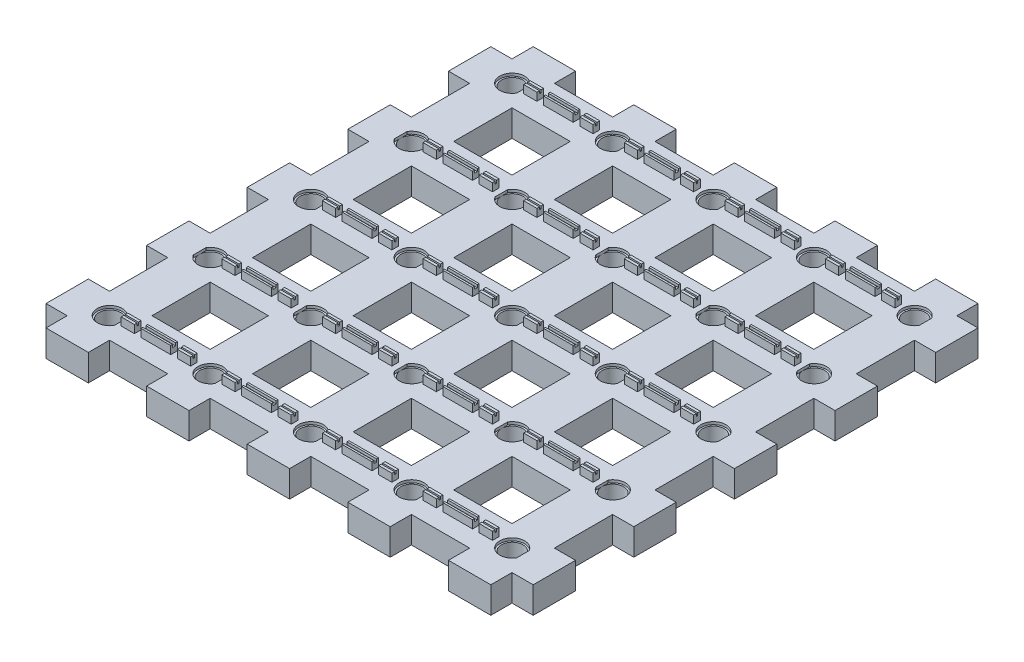
from build123d import *

# Parameters (mm, degrees)
SKETCH1_W                    = 220
SKETCH1_H                    = 220
BOSS_EXTRUDE1_DEPTH          = 10
SKETCH2_R                    = 4.075
CUT_EXTRUDE1_DEPTH           = 10
CUT_EXTRUDE2_DEPTH           = 1
SKETCH4_W                    = 220
SKETCH4_H                    = 220
SKETCH4_W_2                  = 22
SKETCH4_H_2                  = 22
CUT_EXTRUDE3_DEPTH           = 156.884572681
SKETCH5_W                    = 5
SKETCH5_H                    = 2.5
SKETCH5_W_2                  = 11.225
SKETCH5_H_2                  = 2.509475446
BOSS_EXTRUDE2_DEPTH          = 3
SKETCH6_W                    = 5
SKETCH6_H                    = 0.55
SKETCH6_W_2                  = 11.225
SKETCH6_H_2                  = 1.1
CUT_EXTRUDE4_DEPTH           = 1
LPATTERN1_COUNT              = 5
LPATTERN1_PITCH              = 38
LPATTERN2_COPY_1_SKETCH_W    = 5
LPATTERN2_COPY_1_SKETCH_H    = 2.5
LPATTERN2_COPY_1_SKETCH_W_2  = 11.225
LPATTERN2_COPY_1_SKETCH_H_2  = 2.509475446
LPATTERN2_COPY_1_DEPTH       = 3
LPATTERN2_COPY_2_SKETCH_W    = 5
LPATTERN2_COPY_2_SKETCH_H    = 2.5
LPATTERN2_COPY_2_SKETCH_W_2  = 11.225
LPATTERN2_COPY_2_SKETCH_H_2  = 2.509475446
LPATTERN2_COPY_2_DEPTH       = 3
LPATTERN2_COPY_3_SKETCH_W    = 5
LPATTERN2_COPY_3_SKETCH_H    = 2.5
LPATTERN2_COPY_3_SKETCH_W_2  = 11.225
LPATTERN2_COPY_3_SKETCH_H_2  = 2.509475446
LPATTERN2_COPY_3_DEPTH       = 3
LPATTERN2_COPY_4_SKETCH_W    = 5
LPATTERN2_COPY_4_SKETCH_H    = 2.5
LPATTERN2_COPY_4_SKETCH_W_2  = 11.225
LPATTERN2_COPY_4_SKETCH_H_2  = 2.509475446
LPATTERN2_COPY_4_DEPTH       = 3
LPATTERN2_COPY_5_SKETCH_W    = 5
LPATTERN2_COPY_5_SKETCH_H    = 2.5
LPATTERN2_COPY_5_SKETCH_W_2  = 11.225
LPATTERN2_COPY_5_SKETCH_H_2  = 2.509475446
LPATTERN2_COPY_5_DEPTH       = 3
LPATTERN2_COPY_6_SKETCH_W    = 5
LPATTERN2_COPY_6_SKETCH_H    = 2.5
LPATTERN2_COPY_6_SKETCH_W_2  = 11.225
LPATTERN2_COPY_6_SKETCH_H_2  = 2.509475446
LPATTERN2_COPY_6_DEPTH       = 3
LPATTERN2_COPY_7_SKETCH_W    = 5
LPATTERN2_COPY_7_SKETCH_H    = 2.5
LPATTERN2_COPY_7_SKETCH_W_2  = 11.225
LPATTERN2_COPY_7_SKETCH_H_2  = 2.509475446
LPATTERN2_COPY_7_DEPTH       = 3
LPATTERN2_COPY_8_SKETCH_W    = 5
LPATTERN2_COPY_8_SKETCH_H    = 2.5
LPATTERN2_COPY_8_SKETCH_W_2  = 11.225
LPATTERN2_COPY_8_SKETCH_H_2  = 2.509475446
LPATTERN2_COPY_8_DEPTH       = 3
LPATTERN2_COPY_9_SKETCH_W    = 5
LPATTERN2_COPY_9_SKETCH_H    = 2.5
LPATTERN2_COPY_9_SKETCH_W_2  = 11.225
LPATTERN2_COPY_9_SKETCH_H_2  = 2.509475446
LPATTERN2_COPY_9_DEPTH       = 3
LPATTERN2_COPY_10_SKETCH_W   = 5
LPATTERN2_COPY_10_SKETCH_H   = 2.5
LPATTERN2_COPY_10_SKETCH_W_2 = 11.225
LPATTERN2_COPY_10_SKETCH_H_2 = 2.509475446
LPATTERN2_COPY_10_DEPTH      = 3
LPATTERN2_COPY_11_SKETCH_W   = 5
LPATTERN2_COPY_11_SKETCH_H   = 2.5
LPATTERN2_COPY_11_SKETCH_W_2 = 11.225
LPATTERN2_COPY_11_SKETCH_H_2 = 2.509475446
LPATTERN2_COPY_11_DEPTH      = 3
LPATTERN2_COPY_12_SKETCH_W   = 5
LPATTERN2_COPY_12_SKETCH_H   = 2.5
LPATTERN2_COPY_12_SKETCH_W_2 = 11.225
LPATTERN2_COPY_12_SKETCH_H_2 = 2.509475446
LPATTERN2_COPY_12_DEPTH      = 3
LPATTERN2_COPY_13_SKETCH_W   = 5
LPATTERN2_COPY_13_SKETCH_H   = 0.55
LPATTERN2_COPY_13_SKETCH_W_2 = 11.225
LPATTERN2_COPY_13_SKETCH_H_2 = 1.1
LPATTERN2_COPY_13_DEPTH      = 1
LPATTERN2_COPY_14_SKETCH_W   = 5
LPATTERN2_COPY_14_SKETCH_H   = 0.55
LPATTERN2_COPY_14_SKETCH_W_2 = 11.225
LPATTERN2_COPY_14_SKETCH_H_2 = 1.1
LPATTERN2_COPY_14_DEPTH      = 1
LPATTERN2_COPY_15_SKETCH_W   = 5
LPATTERN2_COPY_15_SKETCH_H   = 0.55
LPATTERN2_COPY_15_SKETCH_W_2 = 11.225
LPATTERN2_COPY_15_SKETCH_H_2 = 1.1
LPATTERN2_COPY_15_DEPTH      = 1
LPATTERN2_COPY_16_SKETCH_W   = 5
LPATTERN2_COPY_16_SKETCH_H   = 0.55
LPATTERN2_COPY_16_SKETCH_W_2 = 11.225
LPATTERN2_COPY_16_SKETCH_H_2 = 1.1
LPATTERN2_COPY_16_DEPTH      = 1
LPATTERN2_COPY_17_SKETCH_W   = 5
LPATTERN2_COPY_17_SKETCH_H   = 0.55
LPATTERN2_COPY_17_SKETCH_W_2 = 11.225
LPATTERN2_COPY_17_SKETCH_H_2 = 1.1
LPATTERN2_COPY_17_DEPTH      = 1
LPATTERN2_COPY_18_SKETCH_W   = 5
LPATTERN2_COPY_18_SKETCH_H   = 0.55
LPATTERN2_COPY_18_SKETCH_W_2 = 11.225
LPATTERN2_COPY_18_SKETCH_H_2 = 1.1
LPATTERN2_COPY_18_DEPTH      = 1
LPATTERN2_COPY_19_SKETCH_W   = 5
LPATTERN2_COPY_19_SKETCH_H   = 0.55
LPATTERN2_COPY_19_SKETCH_W_2 = 11.225
LPATTERN2_COPY_19_SKETCH_H_2 = 1.1
LPATTERN2_COPY_19_DEPTH      = 1
LPATTERN2_COPY_20_SKETCH_W   = 5
LPATTERN2_COPY_20_SKETCH_H   = 0.55
LPATTERN2_COPY_20_SKETCH_W_2 = 11.225
LPATTERN2_COPY_20_SKETCH_H_2 = 1.1
LPATTERN2_COPY_20_DEPTH      = 1
LPATTERN2_COPY_21_SKETCH_W   = 5
LPATTERN2_COPY_21_SKETCH_H   = 0.55
LPATTERN2_COPY_21_SKETCH_W_2 = 11.225
LPATTERN2_COPY_21_SKETCH_H_2 = 1.1
LPATTERN2_COPY_21_DEPTH      = 1
LPATTERN2_COPY_22_SKETCH_W   = 5
LPATTERN2_COPY_22_SKETCH_H   = 0.55
LPATTERN2_COPY_22_SKETCH_W_2 = 11.225
LPATTERN2_COPY_22_SKETCH_H_2 = 1.1
LPATTERN2_COPY_22_DEPTH      = 1
LPATTERN2_COPY_23_SKETCH_W   = 5
LPATTERN2_COPY_23_SKETCH_H   = 0.55
LPATTERN2_COPY_23_SKETCH_W_2 = 11.225
LPATTERN2_COPY_23_SKETCH_H_2 = 1.1
LPATTERN2_COPY_23_DEPTH      = 1
LPATTERN2_COPY_24_SKETCH_W   = 5
LPATTERN2_COPY_24_SKETCH_H   = 0.55
LPATTERN2_COPY_24_SKETCH_W_2 = 11.225
LPATTERN2_COPY_24_SKETCH_H_2 = 1.1
LPATTERN2_COPY_24_DEPTH      = 1
LPATTERN2_COPY_25_SKETCH_W   = 5
LPATTERN2_COPY_25_SKETCH_H   = 2.5
LPATTERN2_COPY_25_SKETCH_W_2 = 11.225
LPATTERN2_COPY_25_SKETCH_H_2 = 2.509475446
LPATTERN2_COPY_25_DEPTH      = 3
LPATTERN2_COPY_26_SKETCH_W   = 5
LPATTERN2_COPY_26_SKETCH_H   = 2.5
LPATTERN2_COPY_26_SKETCH_W_2 = 11.225
LPATTERN2_COPY_26_SKETCH_H_2 = 2.509475446
LPATTERN2_COPY_26_DEPTH      = 3
LPATTERN2_COPY_27_SKETCH_W   = 5
LPATTERN2_COPY_27_SKETCH_H   = 2.5
LPATTERN2_COPY_27_SKETCH_W_2 = 11.225
LPATTERN2_COPY_27_SKETCH_H_2 = 2.509475446
LPATTERN2_COPY_27_DEPTH      = 3
LPATTERN2_COPY_28_SKETCH_W   = 5
LPATTERN2_COPY_28_SKETCH_H   = 0.55
LPATTERN2_COPY_28_SKETCH_W_2 = 11.225
LPATTERN2_COPY_28_SKETCH_H_2 = 1.1
LPATTERN2_COPY_28_DEPTH      = 1
LPATTERN2_COPY_29_SKETCH_W   = 5
LPATTERN2_COPY_29_SKETCH_H   = 0.55
LPATTERN2_COPY_29_SKETCH_W_2 = 11.225
LPATTERN2_COPY_29_SKETCH_H_2 = 1.1
LPATTERN2_COPY_29_DEPTH      = 1
LPATTERN2_COPY_30_SKETCH_W   = 5
LPATTERN2_COPY_30_SKETCH_H   = 0.55
LPATTERN2_COPY_30_SKETCH_W_2 = 11.225
LPATTERN2_COPY_30_SKETCH_H_2 = 1.1
LPATTERN2_COPY_30_DEPTH      = 1


with BuildPart() as part:
    # Sketch1 → Boss-Extrude1 (new body)
    with BuildSketch(Plane(origin=(0, 0, 0), x_dir=(1, 0, 0), z_dir=(0, 1, 0))):
        Rectangle(SKETCH1_W, SKETCH1_H)
    extrude(amount=BOSS_EXTRUDE1_DEPTH)

    # Sketch2 → Cut-Extrude1 (cut)
    with BuildSketch(Plane(origin=(0, 10, 0), x_dir=(1, 0, 0), z_dir=(0, 1, 0))):
        with Locations((-76, -75.925)):
            Circle(SKETCH2_R)
        with Locations((-38, -75.925)):
            Circle(SKETCH2_R)
        with Locations((0, -75.925)):
            Circle(SKETCH2_R)
        with Locations((38, -75.925)):
            Circle(SKETCH2_R)
        with Locations((76, -75.925)):
            Circle(SKETCH2_R)
        with Locations((-76, -37.925)):
            Circle(SKETCH2_R)
        with Locations((-38, -37.925)):
            Circle(SKETCH2_R)
        with Locations((0, -37.925)):
            Circle(SKETCH2_R)
        with Locations((38, -37.925)):
            Circle(SKETCH2_R)
        with Locations((76, -37.925)):
            Circle(SKETCH2_R)
        with Locations((-76, 0.075)):
            Circle(SKETCH2_R)
        with Locations((-38, 0.075)):
            Circle(SKETCH2_R)
        with Locations((0, 0.075)):
            Circle(SKETCH2_R)
        with Locations((38, 0.075)):
            Circle(SKETCH2_R)
        with Locations((76, 0.075)):
            Circle(SKETCH2_R)
        with Locations((-76, 38.075)):
            Circle(SKETCH2_R)
        with Locations((-38, 38.075)):
            Circle(SKETCH2_R)
        with Locations((0, 38.075)):
            Circle(SKETCH2_R)
        with Locations((38, 38.075)):
            Circle(SKETCH2_R)
        with Locations((76, 38.075)):
            Circle(SKETCH2_R)
        with Locations((-76, 76.075)):
            Circle(SKETCH2_R)
        with Locations((-38, 76.075)):
            Circle(SKETCH2_R)
        with Locations((0, 76.075)):
            Circle(SKETCH2_R)
        with Locations((38, 76.075)):
            Circle(SKETCH2_R)
        with Locations((76, 76.075)):
            Circle(SKETCH2_R)
    extrude(amount=-CUT_EXTRUDE1_DEPTH, mode=Mode.SUBTRACT)

    # Sketch3 → Cut-Extrude2 (cut)
    with BuildSketch(Plane(origin=(0, 10, 0), x_dir=(1, 0, 0), z_dir=(0, 1, 0))):
        with BuildLine():
            Line((-71.925, -78.266874249), (-71.925, -73.583125751))
            ThreePointArc((-71.925, -73.583125751), (-80.7, -75.925), (-71.925, -78.266874249))
        make_face()
        with BuildLine():
            Line((-80.075, -35.583125751), (-80.075, -40.266874249))
            ThreePointArc((-80.075, -40.266874249), (-71.3, -37.925), (-80.075, -35.583125751))
        make_face()
        with BuildLine():
            Line((-71.925, -2.266874249), (-71.925, 2.416874249))
            ThreePointArc((-71.925, 2.416874249), (-80.7, 0.075), (-71.925, -2.266874249))
        make_face()
        with BuildLine():
            Line((-80.075, 40.416874249), (-80.075, 35.733125751))
            ThreePointArc((-80.075, 35.733125751), (-71.3, 38.075), (-80.075, 40.416874249))
        make_face()
        with BuildLine():
            Line((-71.925, 73.733125751), (-71.925, 78.416874249))
            ThreePointArc((-71.925, 78.416874249), (-80.7, 76.075), (-71.925, 73.733125751))
        make_face()
        with BuildLine():
            Line((-33.925, 73.733125751), (-33.925, 78.416874249))
            ThreePointArc((-33.925, 78.416874249), (-42.7, 76.075), (-33.925, 73.733125751))
        make_face()
        with BuildLine():
            Line((-42.075, 40.416874249), (-42.075, 35.733125751))
            ThreePointArc((-42.075, 35.733125751), (-33.3, 38.075), (-42.075, 40.416874249))
        make_face()
        with BuildLine():
            Line((-33.925, -2.266874249), (-33.925, 2.416874249))
            ThreePointArc((-33.925, 2.416874249), (-42.7, 0.075), (-33.925, -2.266874249))
        make_face()
        with BuildLine():
            Line((-33.925, -78.266874249), (-33.925, -73.583125751))
            ThreePointArc((-33.925, -73.583125751), (-42.7, -75.925), (-33.925, -78.266874249))
        make_face()
        with BuildLine():
            Line((-42.075, -35.583125751), (-42.075, -40.266874249))
            ThreePointArc((-42.075, -40.266874249), (-33.3, -37.925), (-42.075, -35.583125751))
        make_face()
        with BuildLine():
            Line((4.075, 73.733125751), (4.075, 78.416874249))
            ThreePointArc((4.075, 78.416874249), (-4.7, 76.075), (4.075, 73.733125751))
        make_face()
        with BuildLine():
            Line((-4.075, 40.416874249), (-4.075, 35.733125751))
            ThreePointArc((-4.075, 35.733125751), (4.7, 38.075), (-4.075, 40.416874249))
        make_face()
        with BuildLine():
            Line((4.075, -2.266874249), (4.075, 2.416874249))
            ThreePointArc((4.075, 2.416874249), (-4.7, 0.075), (4.075, -2.266874249))
        make_face()
        with BuildLine():
            Line((4.075, -78.266874249), (4.075, -73.583125751))
            ThreePointArc((4.075, -73.583125751), (-4.7, -75.925), (4.075, -78.266874249))
        make_face()
        with BuildLine():
            Line((-4.075, -35.583125751), (-4.075, -40.266874249))
            ThreePointArc((-4.075, -40.266874249), (4.7, -37.925), (-4.075, -35.583125751))
        make_face()
        with BuildLine():
            Line((42.075, 73.733125751), (42.075, 78.416874249))
            ThreePointArc((42.075, 78.416874249), (33.3, 76.075), (42.075, 73.733125751))
        make_face()
        with BuildLine():
            Line((33.925, 40.416874249), (33.925, 35.733125751))
            ThreePointArc((33.925, 35.733125751), (42.7, 38.075), (33.925, 40.416874249))
        make_face()
        with BuildLine():
            Line((42.075, -2.266874249), (42.075, 2.416874249))
            ThreePointArc((42.075, 2.416874249), (33.3, 0.075), (42.075, -2.266874249))
        make_face()
        with BuildLine():
            Line((42.075, -78.266874249), (42.075, -73.583125751))
            ThreePointArc((42.075, -73.583125751), (33.3, -75.925), (42.075, -78.266874249))
        make_face()
        with BuildLine():
            Line((33.925, -35.583125751), (33.925, -40.266874249))
            ThreePointArc((33.925, -40.266874249), (42.7, -37.925), (33.925, -35.583125751))
        make_face()
        with BuildLine():
            Line((80.075, 73.733125751), (80.075, 78.416874249))
            ThreePointArc((80.075, 78.416874249), (71.3, 76.075), (80.075, 73.733125751))
        make_face()
        with BuildLine():
            Line((71.925, 40.416874249), (71.925, 35.733125751))
            ThreePointArc((71.925, 35.733125751), (80.7, 38.075), (71.925, 40.416874249))
        make_face()
        with BuildLine():
            Line((80.075, -2.266874249), (80.075, 2.416874249))
            ThreePointArc((80.075, 2.416874249), (71.3, 0.075), (80.075, -2.266874249))
        make_face()
        with BuildLine():
            Line((80.075, -78.266874249), (80.075, -73.583125751))
            ThreePointArc((80.075, -73.583125751), (71.3, -75.925), (80.075, -78.266874249))
        make_face()
        with BuildLine():
            Line((71.925, -35.583125751), (71.925, -40.266874249))
            ThreePointArc((71.925, -40.266874249), (80.7, -37.925), (71.925, -35.583125751))
        make_face()
    extrude(amount=-CUT_EXTRUDE2_DEPTH, mode=Mode.SUBTRACT)

    # Sketch4 → Cut-Extrude3 (cut, through all)
    # profile 1 of 17: a face of its own
    with BuildSketch(Plane(origin=(0, 10, 0), x_dir=(1, 0, 0), z_dir=(0, 1, 0))):
        Rectangle(SKETCH4_W, SKETCH4_H)
        Polygon((-68, 92), (-68, 84), (-46, 84), (-46, 92), (-30, 92), (-30, 84), (-8, 84), (-8, 92), (8, 92), (8, 84), (30, 84), (30, 92), (46, 92), (46, 84), (68, 84), (68, 92), (84, 92), (84, 84), (92, 84), (92, 68), (84, 68), (84, 46), (92, 46), (92, 30), (84, 30), (84, 8), (92, 8), (92, -8), (84, -8), (84, -30), (92, -30), (92, -46), (84, -46), (84, -68), (92, -68), (92, -84), (84, -84), (84, -92), (68, -92), (68, -84), (46, -84), (46, -92), (30, -92), (30, -84), (8, -84), (8, -92), (-8, -92), (-8, -84), (-30, -84), (-30, -92), (-46, -92), (-46, -84), (-68, -84), (-68, -92), (-84, -92), (-84, -84), (-92, -84), (-92, -68), (-84, -68), (-84, -46), (-92, -46), (-92, -30), (-84, -30), (-84, -8), (-92, -8), (-92, 8), (-84, 8), (-84, 30), (-92, 30), (-92, 46), (-84, 46), (-84, 68), (-92, 68), (-92, 84), (-84, 84), (-84, 92), align=None, mode=Mode.SUBTRACT)
    # profile 2 of 17: a face of its own
    with BuildSketch(Plane(origin=(0, 10, 0), x_dir=(1, 0, 0), z_dir=(0, 1, 0))):
        with Locations((-57, -57)):
            Rectangle(SKETCH4_W_2, SKETCH4_H_2)
    # profile 3 of 17: a face of its own
    with BuildSketch(Plane(origin=(0, 10, 0), x_dir=(1, 0, 0), z_dir=(0, 1, 0))):
        with Locations((57, -57)):
            Rectangle(SKETCH4_W_2, SKETCH4_H_2)
    # profile 4 of 17: a face of its own
    with BuildSketch(Plane(origin=(0, 10, 0), x_dir=(1, 0, 0), z_dir=(0, 1, 0))):
        with Locations((19, -57)):
            Rectangle(SKETCH4_W_2, SKETCH4_H_2)
    # profile 5 of 17: a face of its own
    with BuildSketch(Plane(origin=(0, 10, 0), x_dir=(1, 0, 0), z_dir=(0, 1, 0))):
        with Locations((-19, -57)):
            Rectangle(SKETCH4_W_2, SKETCH4_H_2)
    # profile 6 of 17: a face of its own
    with BuildSketch(Plane(origin=(0, 10, 0), x_dir=(1, 0, 0), z_dir=(0, 1, 0))):
        with Locations((-57, -19)):
            Rectangle(SKETCH4_W_2, SKETCH4_H_2)
    # profile 7 of 17: a face of its own
    with BuildSketch(Plane(origin=(0, 10, 0), x_dir=(1, 0, 0), z_dir=(0, 1, 0))):
        with Locations((57, -19)):
            Rectangle(SKETCH4_W_2, SKETCH4_H_2)
    # profile 8 of 17: a face of its own
    with BuildSketch(Plane(origin=(0, 10, 0), x_dir=(1, 0, 0), z_dir=(0, 1, 0))):
        with Locations((19, -19)):
            Rectangle(SKETCH4_W_2, SKETCH4_H_2)
    # profile 9 of 17: a face of its own
    with BuildSketch(Plane(origin=(0, 10, 0), x_dir=(1, 0, 0), z_dir=(0, 1, 0))):
        with Locations((-19, -19)):
            Rectangle(SKETCH4_W_2, SKETCH4_H_2)
    # profile 10 of 17: a face of its own
    with BuildSketch(Plane(origin=(0, 10, 0), x_dir=(1, 0, 0), z_dir=(0, 1, 0))):
        with Locations((-57, 19)):
            Rectangle(SKETCH4_W_2, SKETCH4_H_2)
    # profile 11 of 17: a face of its own
    with BuildSketch(Plane(origin=(0, 10, 0), x_dir=(1, 0, 0), z_dir=(0, 1, 0))):
        with Locations((57, 19)):
            Rectangle(SKETCH4_W_2, SKETCH4_H_2)
    # profile 12 of 17: a face of its own
    with BuildSketch(Plane(origin=(0, 10, 0), x_dir=(1, 0, 0), z_dir=(0, 1, 0))):
        with Locations((19, 19)):
            Rectangle(SKETCH4_W_2, SKETCH4_H_2)
    # profile 13 of 17: a face of its own
    with BuildSketch(Plane(origin=(0, 10, 0), x_dir=(1, 0, 0), z_dir=(0, 1, 0))):
        with Locations((-19, 19)):
            Rectangle(SKETCH4_W_2, SKETCH4_H_2)
    # profile 14 of 17: a face of its own
    with BuildSketch(Plane(origin=(0, 10, 0), x_dir=(1, 0, 0), z_dir=(0, 1, 0))):
        with Locations((57, 57)):
            Rectangle(SKETCH4_W_2, SKETCH4_H_2)
    # profile 15 of 17: a face of its own
    with BuildSketch(Plane(origin=(0, 10, 0), x_dir=(1, 0, 0), z_dir=(0, 1, 0))):
        with Locations((19, 57)):
            Rectangle(SKETCH4_W_2, SKETCH4_H_2)
    # profile 16 of 17: a face of its own
    with BuildSketch(Plane(origin=(0, 10, 0), x_dir=(1, 0, 0), z_dir=(0, 1, 0))):
        with Locations((-19, 57)):
            Rectangle(SKETCH4_W_2, SKETCH4_H_2)
    # profile 17 of 17: a face of its own
    with BuildSketch(Plane(origin=(0, 10, 0), x_dir=(1, 0, 0), z_dir=(0, 1, 0))):
        with Locations((-57, 57)):
            Rectangle(SKETCH4_W_2, SKETCH4_H_2)
    extrude(amount=-CUT_EXTRUDE3_DEPTH, mode=Mode.SUBTRACT)

    # Sketch5 → Boss-Extrude2 (add)
    with BuildSketch(Plane(origin=(0, 10, 0), x_dir=(1, 0, 0), z_dir=(0, 1, 0))):
        with Locations((-67.925, 76.071395089)):
            Rectangle(SKETCH5_W, SKETCH5_H)
        with Locations((-46.7, 76.071395089)):
            Rectangle(SKETCH5_W, SKETCH5_H)
        with Locations((-57.3125, 76.066657366)):
            Rectangle(SKETCH5_W_2, SKETCH5_H_2)
    boss_extrude2 = extrude(amount=BOSS_EXTRUDE2_DEPTH)

    # Sketch6 → Cut-Extrude4 (cut)
    with BuildSketch(Plane(origin=(0, 13, 0), x_dir=(1, 0, 0), z_dir=(0, 1, 0))):
        with Locations((-67.925, 76.071395089)):
            Rectangle(SKETCH6_W, SKETCH6_H)
        with Locations((-57.3125, 76.066657366)):
            Rectangle(SKETCH6_W_2, SKETCH6_H_2)
        with Locations((-46.7, 76.071395089)):
            Rectangle(SKETCH6_W, SKETCH6_H)
    cut_extrude4 = extrude(amount=-CUT_EXTRUDE4_DEPTH, mode=Mode.SUBTRACT)

    # LPattern1: Boss-Extrude2, Cut-Extrude4 ×5
    with Locations(*[(0, 0, i * LPATTERN1_PITCH) for i in range(1, LPATTERN1_COUNT)]):
        add(boss_extrude2)
        add(cut_extrude4, mode=Mode.SUBTRACT)

    # LPattern2 copy 1 sketch → LPattern2 copy 1 (add)
    with BuildSketch(Plane(origin=(38, 10, 38), x_dir=(1, 0, 0), z_dir=(0, 1, 0))):
        with Locations((-67.925, 76.071395089)):
            Rectangle(LPATTERN2_COPY_1_SKETCH_W, LPATTERN2_COPY_1_SKETCH_H)
        with Locations((-46.7, 76.071395089)):
            Rectangle(LPATTERN2_COPY_1_SKETCH_W, LPATTERN2_COPY_1_SKETCH_H)
        with Locations((-57.3125, 76.066657366)):
            Rectangle(LPATTERN2_COPY_1_SKETCH_W_2, LPATTERN2_COPY_1_SKETCH_H_2)
    extrude(amount=LPATTERN2_COPY_1_DEPTH)

    # LPattern2 copy 2 sketch → LPattern2 copy 2 (add)
    with BuildSketch(Plane(origin=(76, 10, 38), x_dir=(1, 0, 0), z_dir=(0, 1, 0))):
        with Locations((-67.925, 76.071395089)):
            Rectangle(LPATTERN2_COPY_2_SKETCH_W, LPATTERN2_COPY_2_SKETCH_H)
        with Locations((-46.7, 76.071395089)):
            Rectangle(LPATTERN2_COPY_2_SKETCH_W, LPATTERN2_COPY_2_SKETCH_H)
        with Locations((-57.3125, 76.066657366)):
            Rectangle(LPATTERN2_COPY_2_SKETCH_W_2, LPATTERN2_COPY_2_SKETCH_H_2)
    extrude(amount=LPATTERN2_COPY_2_DEPTH)

    # LPattern2 copy 3 sketch → LPattern2 copy 3 (add)
    with BuildSketch(Plane(origin=(114, 10, 38), x_dir=(1, 0, 0), z_dir=(0, 1, 0))):
        with Locations((-67.925, 76.071395089)):
            Rectangle(LPATTERN2_COPY_3_SKETCH_W, LPATTERN2_COPY_3_SKETCH_H)
        with Locations((-46.7, 76.071395089)):
            Rectangle(LPATTERN2_COPY_3_SKETCH_W, LPATTERN2_COPY_3_SKETCH_H)
        with Locations((-57.3125, 76.066657366)):
            Rectangle(LPATTERN2_COPY_3_SKETCH_W_2, LPATTERN2_COPY_3_SKETCH_H_2)
    extrude(amount=LPATTERN2_COPY_3_DEPTH)

    # LPattern2 copy 4 sketch → LPattern2 copy 4 (add)
    with BuildSketch(Plane(origin=(38, 10, 76), x_dir=(1, 0, 0), z_dir=(0, 1, 0))):
        with Locations((-67.925, 76.071395089)):
            Rectangle(LPATTERN2_COPY_4_SKETCH_W, LPATTERN2_COPY_4_SKETCH_H)
        with Locations((-46.7, 76.071395089)):
            Rectangle(LPATTERN2_COPY_4_SKETCH_W, LPATTERN2_COPY_4_SKETCH_H)
        with Locations((-57.3125, 76.066657366)):
            Rectangle(LPATTERN2_COPY_4_SKETCH_W_2, LPATTERN2_COPY_4_SKETCH_H_2)
    extrude(amount=LPATTERN2_COPY_4_DEPTH)

    # LPattern2 copy 5 sketch → LPattern2 copy 5 (add)
    with BuildSketch(Plane(origin=(76, 10, 76), x_dir=(1, 0, 0), z_dir=(0, 1, 0))):
        with Locations((-67.925, 76.071395089)):
            Rectangle(LPATTERN2_COPY_5_SKETCH_W, LPATTERN2_COPY_5_SKETCH_H)
        with Locations((-46.7, 76.071395089)):
            Rectangle(LPATTERN2_COPY_5_SKETCH_W, LPATTERN2_COPY_5_SKETCH_H)
        with Locations((-57.3125, 76.066657366)):
            Rectangle(LPATTERN2_COPY_5_SKETCH_W_2, LPATTERN2_COPY_5_SKETCH_H_2)
    extrude(amount=LPATTERN2_COPY_5_DEPTH)

    # LPattern2 copy 6 sketch → LPattern2 copy 6 (add)
    with BuildSketch(Plane(origin=(114, 10, 76), x_dir=(1, 0, 0), z_dir=(0, 1, 0))):
        with Locations((-67.925, 76.071395089)):
            Rectangle(LPATTERN2_COPY_6_SKETCH_W, LPATTERN2_COPY_6_SKETCH_H)
        with Locations((-46.7, 76.071395089)):
            Rectangle(LPATTERN2_COPY_6_SKETCH_W, LPATTERN2_COPY_6_SKETCH_H)
        with Locations((-57.3125, 76.066657366)):
            Rectangle(LPATTERN2_COPY_6_SKETCH_W_2, LPATTERN2_COPY_6_SKETCH_H_2)
    extrude(amount=LPATTERN2_COPY_6_DEPTH)

    # LPattern2 copy 7 sketch → LPattern2 copy 7 (add)
    with BuildSketch(Plane(origin=(38, 10, 114), x_dir=(1, 0, 0), z_dir=(0, 1, 0))):
        with Locations((-67.925, 76.071395089)):
            Rectangle(LPATTERN2_COPY_7_SKETCH_W, LPATTERN2_COPY_7_SKETCH_H)
        with Locations((-46.7, 76.071395089)):
            Rectangle(LPATTERN2_COPY_7_SKETCH_W, LPATTERN2_COPY_7_SKETCH_H)
        with Locations((-57.3125, 76.066657366)):
            Rectangle(LPATTERN2_COPY_7_SKETCH_W_2, LPATTERN2_COPY_7_SKETCH_H_2)
    extrude(amount=LPATTERN2_COPY_7_DEPTH)

    # LPattern2 copy 8 sketch → LPattern2 copy 8 (add)
    with BuildSketch(Plane(origin=(76, 10, 114), x_dir=(1, 0, 0), z_dir=(0, 1, 0))):
        with Locations((-67.925, 76.071395089)):
            Rectangle(LPATTERN2_COPY_8_SKETCH_W, LPATTERN2_COPY_8_SKETCH_H)
        with Locations((-46.7, 76.071395089)):
            Rectangle(LPATTERN2_COPY_8_SKETCH_W, LPATTERN2_COPY_8_SKETCH_H)
        with Locations((-57.3125, 76.066657366)):
            Rectangle(LPATTERN2_COPY_8_SKETCH_W_2, LPATTERN2_COPY_8_SKETCH_H_2)
    extrude(amount=LPATTERN2_COPY_8_DEPTH)

    # LPattern2 copy 9 sketch → LPattern2 copy 9 (add)
    with BuildSketch(Plane(origin=(114, 10, 114), x_dir=(1, 0, 0), z_dir=(0, 1, 0))):
        with Locations((-67.925, 76.071395089)):
            Rectangle(LPATTERN2_COPY_9_SKETCH_W, LPATTERN2_COPY_9_SKETCH_H)
        with Locations((-46.7, 76.071395089)):
            Rectangle(LPATTERN2_COPY_9_SKETCH_W, LPATTERN2_COPY_9_SKETCH_H)
        with Locations((-57.3125, 76.066657366)):
            Rectangle(LPATTERN2_COPY_9_SKETCH_W_2, LPATTERN2_COPY_9_SKETCH_H_2)
    extrude(amount=LPATTERN2_COPY_9_DEPTH)

    # LPattern2 copy 10 sketch → LPattern2 copy 10 (add)
    with BuildSketch(Plane(origin=(38, 10, 152), x_dir=(1, 0, 0), z_dir=(0, 1, 0))):
        with Locations((-67.925, 76.071395089)):
            Rectangle(LPATTERN2_COPY_10_SKETCH_W, LPATTERN2_COPY_10_SKETCH_H)
        with Locations((-46.7, 76.071395089)):
            Rectangle(LPATTERN2_COPY_10_SKETCH_W, LPATTERN2_COPY_10_SKETCH_H)
        with Locations((-57.3125, 76.066657366)):
            Rectangle(LPATTERN2_COPY_10_SKETCH_W_2, LPATTERN2_COPY_10_SKETCH_H_2)
    extrude(amount=LPATTERN2_COPY_10_DEPTH)

    # LPattern2 copy 11 sketch → LPattern2 copy 11 (add)
    with BuildSketch(Plane(origin=(76, 10, 152), x_dir=(1, 0, 0), z_dir=(0, 1, 0))):
        with Locations((-67.925, 76.071395089)):
            Rectangle(LPATTERN2_COPY_11_SKETCH_W, LPATTERN2_COPY_11_SKETCH_H)
        with Locations((-46.7, 76.071395089)):
            Rectangle(LPATTERN2_COPY_11_SKETCH_W, LPATTERN2_COPY_11_SKETCH_H)
        with Locations((-57.3125, 76.066657366)):
            Rectangle(LPATTERN2_COPY_11_SKETCH_W_2, LPATTERN2_COPY_11_SKETCH_H_2)
    extrude(amount=LPATTERN2_COPY_11_DEPTH)

    # LPattern2 copy 12 sketch → LPattern2 copy 12 (add)
    with BuildSketch(Plane(origin=(114, 10, 152), x_dir=(1, 0, 0), z_dir=(0, 1, 0))):
        with Locations((-67.925, 76.071395089)):
            Rectangle(LPATTERN2_COPY_12_SKETCH_W, LPATTERN2_COPY_12_SKETCH_H)
        with Locations((-46.7, 76.071395089)):
            Rectangle(LPATTERN2_COPY_12_SKETCH_W, LPATTERN2_COPY_12_SKETCH_H)
        with Locations((-57.3125, 76.066657366)):
            Rectangle(LPATTERN2_COPY_12_SKETCH_W_2, LPATTERN2_COPY_12_SKETCH_H_2)
    extrude(amount=LPATTERN2_COPY_12_DEPTH)

    # LPattern2 copy 13 sketch → LPattern2 copy 13 (cut)
    with BuildSketch(Plane(origin=(38, 13, 38), x_dir=(1, 0, 0), z_dir=(0, 1, 0))):
        with Locations((-67.925, 76.071395089)):
            Rectangle(LPATTERN2_COPY_13_SKETCH_W, LPATTERN2_COPY_13_SKETCH_H)
        with Locations((-57.3125, 76.066657366)):
            Rectangle(LPATTERN2_COPY_13_SKETCH_W_2, LPATTERN2_COPY_13_SKETCH_H_2)
        with Locations((-46.7, 76.071395089)):
            Rectangle(LPATTERN2_COPY_13_SKETCH_W, LPATTERN2_COPY_13_SKETCH_H)
    extrude(amount=-LPATTERN2_COPY_13_DEPTH, mode=Mode.SUBTRACT)

    # LPattern2 copy 14 sketch → LPattern2 copy 14 (cut)
    with BuildSketch(Plane(origin=(76, 13, 38), x_dir=(1, 0, 0), z_dir=(0, 1, 0))):
        with Locations((-67.925, 76.071395089)):
            Rectangle(LPATTERN2_COPY_14_SKETCH_W, LPATTERN2_COPY_14_SKETCH_H)
        with Locations((-57.3125, 76.066657366)):
            Rectangle(LPATTERN2_COPY_14_SKETCH_W_2, LPATTERN2_COPY_14_SKETCH_H_2)
        with Locations((-46.7, 76.071395089)):
            Rectangle(LPATTERN2_COPY_14_SKETCH_W, LPATTERN2_COPY_14_SKETCH_H)
    extrude(amount=-LPATTERN2_COPY_14_DEPTH, mode=Mode.SUBTRACT)

    # LPattern2 copy 15 sketch → LPattern2 copy 15 (cut)
    with BuildSketch(Plane(origin=(114, 13, 38), x_dir=(1, 0, 0), z_dir=(0, 1, 0))):
        with Locations((-67.925, 76.071395089)):
            Rectangle(LPATTERN2_COPY_15_SKETCH_W, LPATTERN2_COPY_15_SKETCH_H)
        with Locations((-57.3125, 76.066657366)):
            Rectangle(LPATTERN2_COPY_15_SKETCH_W_2, LPATTERN2_COPY_15_SKETCH_H_2)
        with Locations((-46.7, 76.071395089)):
            Rectangle(LPATTERN2_COPY_15_SKETCH_W, LPATTERN2_COPY_15_SKETCH_H)
    extrude(amount=-LPATTERN2_COPY_15_DEPTH, mode=Mode.SUBTRACT)

    # LPattern2 copy 16 sketch → LPattern2 copy 16 (cut)
    with BuildSketch(Plane(origin=(38, 13, 76), x_dir=(1, 0, 0), z_dir=(0, 1, 0))):
        with Locations((-67.925, 76.071395089)):
            Rectangle(LPATTERN2_COPY_16_SKETCH_W, LPATTERN2_COPY_16_SKETCH_H)
        with Locations((-57.3125, 76.066657366)):
            Rectangle(LPATTERN2_COPY_16_SKETCH_W_2, LPATTERN2_COPY_16_SKETCH_H_2)
        with Locations((-46.7, 76.071395089)):
            Rectangle(LPATTERN2_COPY_16_SKETCH_W, LPATTERN2_COPY_16_SKETCH_H)
    extrude(amount=-LPATTERN2_COPY_16_DEPTH, mode=Mode.SUBTRACT)

    # LPattern2 copy 17 sketch → LPattern2 copy 17 (cut)
    with BuildSketch(Plane(origin=(76, 13, 76), x_dir=(1, 0, 0), z_dir=(0, 1, 0))):
        with Locations((-67.925, 76.071395089)):
            Rectangle(LPATTERN2_COPY_17_SKETCH_W, LPATTERN2_COPY_17_SKETCH_H)
        with Locations((-57.3125, 76.066657366)):
            Rectangle(LPATTERN2_COPY_17_SKETCH_W_2, LPATTERN2_COPY_17_SKETCH_H_2)
        with Locations((-46.7, 76.071395089)):
            Rectangle(LPATTERN2_COPY_17_SKETCH_W, LPATTERN2_COPY_17_SKETCH_H)
    extrude(amount=-LPATTERN2_COPY_17_DEPTH, mode=Mode.SUBTRACT)

    # LPattern2 copy 18 sketch → LPattern2 copy 18 (cut)
    with BuildSketch(Plane(origin=(114, 13, 76), x_dir=(1, 0, 0), z_dir=(0, 1, 0))):
        with Locations((-67.925, 76.071395089)):
            Rectangle(LPATTERN2_COPY_18_SKETCH_W, LPATTERN2_COPY_18_SKETCH_H)
        with Locations((-57.3125, 76.066657366)):
            Rectangle(LPATTERN2_COPY_18_SKETCH_W_2, LPATTERN2_COPY_18_SKETCH_H_2)
        with Locations((-46.7, 76.071395089)):
            Rectangle(LPATTERN2_COPY_18_SKETCH_W, LPATTERN2_COPY_18_SKETCH_H)
    extrude(amount=-LPATTERN2_COPY_18_DEPTH, mode=Mode.SUBTRACT)

    # LPattern2 copy 19 sketch → LPattern2 copy 19 (cut)
    with BuildSketch(Plane(origin=(38, 13, 114), x_dir=(1, 0, 0), z_dir=(0, 1, 0))):
        with Locations((-67.925, 76.071395089)):
            Rectangle(LPATTERN2_COPY_19_SKETCH_W, LPATTERN2_COPY_19_SKETCH_H)
        with Locations((-57.3125, 76.066657366)):
            Rectangle(LPATTERN2_COPY_19_SKETCH_W_2, LPATTERN2_COPY_19_SKETCH_H_2)
        with Locations((-46.7, 76.071395089)):
            Rectangle(LPATTERN2_COPY_19_SKETCH_W, LPATTERN2_COPY_19_SKETCH_H)
    extrude(amount=-LPATTERN2_COPY_19_DEPTH, mode=Mode.SUBTRACT)

    # LPattern2 copy 20 sketch → LPattern2 copy 20 (cut)
    with BuildSketch(Plane(origin=(76, 13, 114), x_dir=(1, 0, 0), z_dir=(0, 1, 0))):
        with Locations((-67.925, 76.071395089)):
            Rectangle(LPATTERN2_COPY_20_SKETCH_W, LPATTERN2_COPY_20_SKETCH_H)
        with Locations((-57.3125, 76.066657366)):
            Rectangle(LPATTERN2_COPY_20_SKETCH_W_2, LPATTERN2_COPY_20_SKETCH_H_2)
        with Locations((-46.7, 76.071395089)):
            Rectangle(LPATTERN2_COPY_20_SKETCH_W, LPATTERN2_COPY_20_SKETCH_H)
    extrude(amount=-LPATTERN2_COPY_20_DEPTH, mode=Mode.SUBTRACT)

    # LPattern2 copy 21 sketch → LPattern2 copy 21 (cut)
    with BuildSketch(Plane(origin=(114, 13, 114), x_dir=(1, 0, 0), z_dir=(0, 1, 0))):
        with Locations((-67.925, 76.071395089)):
            Rectangle(LPATTERN2_COPY_21_SKETCH_W, LPATTERN2_COPY_21_SKETCH_H)
        with Locations((-57.3125, 76.066657366)):
            Rectangle(LPATTERN2_COPY_21_SKETCH_W_2, LPATTERN2_COPY_21_SKETCH_H_2)
        with Locations((-46.7, 76.071395089)):
            Rectangle(LPATTERN2_COPY_21_SKETCH_W, LPATTERN2_COPY_21_SKETCH_H)
    extrude(amount=-LPATTERN2_COPY_21_DEPTH, mode=Mode.SUBTRACT)

    # LPattern2 copy 22 sketch → LPattern2 copy 22 (cut)
    with BuildSketch(Plane(origin=(38, 13, 152), x_dir=(1, 0, 0), z_dir=(0, 1, 0))):
        with Locations((-67.925, 76.071395089)):
            Rectangle(LPATTERN2_COPY_22_SKETCH_W, LPATTERN2_COPY_22_SKETCH_H)
        with Locations((-57.3125, 76.066657366)):
            Rectangle(LPATTERN2_COPY_22_SKETCH_W_2, LPATTERN2_COPY_22_SKETCH_H_2)
        with Locations((-46.7, 76.071395089)):
            Rectangle(LPATTERN2_COPY_22_SKETCH_W, LPATTERN2_COPY_22_SKETCH_H)
    extrude(amount=-LPATTERN2_COPY_22_DEPTH, mode=Mode.SUBTRACT)

    # LPattern2 copy 23 sketch → LPattern2 copy 23 (cut)
    with BuildSketch(Plane(origin=(76, 13, 152), x_dir=(1, 0, 0), z_dir=(0, 1, 0))):
        with Locations((-67.925, 76.071395089)):
            Rectangle(LPATTERN2_COPY_23_SKETCH_W, LPATTERN2_COPY_23_SKETCH_H)
        with Locations((-57.3125, 76.066657366)):
            Rectangle(LPATTERN2_COPY_23_SKETCH_W_2, LPATTERN2_COPY_23_SKETCH_H_2)
        with Locations((-46.7, 76.071395089)):
            Rectangle(LPATTERN2_COPY_23_SKETCH_W, LPATTERN2_COPY_23_SKETCH_H)
    extrude(amount=-LPATTERN2_COPY_23_DEPTH, mode=Mode.SUBTRACT)

    # LPattern2 copy 24 sketch → LPattern2 copy 24 (cut)
    with BuildSketch(Plane(origin=(114, 13, 152), x_dir=(1, 0, 0), z_dir=(0, 1, 0))):
        with Locations((-67.925, 76.071395089)):
            Rectangle(LPATTERN2_COPY_24_SKETCH_W, LPATTERN2_COPY_24_SKETCH_H)
        with Locations((-57.3125, 76.066657366)):
            Rectangle(LPATTERN2_COPY_24_SKETCH_W_2, LPATTERN2_COPY_24_SKETCH_H_2)
        with Locations((-46.7, 76.071395089)):
            Rectangle(LPATTERN2_COPY_24_SKETCH_W, LPATTERN2_COPY_24_SKETCH_H)
    extrude(amount=-LPATTERN2_COPY_24_DEPTH, mode=Mode.SUBTRACT)

    # LPattern2 copy 25 sketch → LPattern2 copy 25 (add)
    with BuildSketch(Plane(origin=(38, 10, 0), x_dir=(1, 0, 0), z_dir=(0, 1, 0))):
        with Locations((-67.925, 76.071395089)):
            Rectangle(LPATTERN2_COPY_25_SKETCH_W, LPATTERN2_COPY_25_SKETCH_H)
        with Locations((-46.7, 76.071395089)):
            Rectangle(LPATTERN2_COPY_25_SKETCH_W, LPATTERN2_COPY_25_SKETCH_H)
        with Locations((-57.3125, 76.066657366)):
            Rectangle(LPATTERN2_COPY_25_SKETCH_W_2, LPATTERN2_COPY_25_SKETCH_H_2)
    extrude(amount=LPATTERN2_COPY_25_DEPTH)

    # LPattern2 copy 26 sketch → LPattern2 copy 26 (add)
    with BuildSketch(Plane(origin=(76, 10, 0), x_dir=(1, 0, 0), z_dir=(0, 1, 0))):
        with Locations((-67.925, 76.071395089)):
            Rectangle(LPATTERN2_COPY_26_SKETCH_W, LPATTERN2_COPY_26_SKETCH_H)
        with Locations((-46.7, 76.071395089)):
            Rectangle(LPATTERN2_COPY_26_SKETCH_W, LPATTERN2_COPY_26_SKETCH_H)
        with Locations((-57.3125, 76.066657366)):
            Rectangle(LPATTERN2_COPY_26_SKETCH_W_2, LPATTERN2_COPY_26_SKETCH_H_2)
    extrude(amount=LPATTERN2_COPY_26_DEPTH)

    # LPattern2 copy 27 sketch → LPattern2 copy 27 (add)
    with BuildSketch(Plane(origin=(114, 10, 0), x_dir=(1, 0, 0), z_dir=(0, 1, 0))):
        with Locations((-67.925, 76.071395089)):
            Rectangle(LPATTERN2_COPY_27_SKETCH_W, LPATTERN2_COPY_27_SKETCH_H)
        with Locations((-46.7, 76.071395089)):
            Rectangle(LPATTERN2_COPY_27_SKETCH_W, LPATTERN2_COPY_27_SKETCH_H)
        with Locations((-57.3125, 76.066657366)):
            Rectangle(LPATTERN2_COPY_27_SKETCH_W_2, LPATTERN2_COPY_27_SKETCH_H_2)
    extrude(amount=LPATTERN2_COPY_27_DEPTH)

    # LPattern2 copy 28 sketch → LPattern2 copy 28 (cut)
    with BuildSketch(Plane(origin=(38, 13, 0), x_dir=(1, 0, 0), z_dir=(0, 1, 0))):
        with Locations((-67.925, 76.071395089)):
            Rectangle(LPATTERN2_COPY_28_SKETCH_W, LPATTERN2_COPY_28_SKETCH_H)
        with Locations((-57.3125, 76.066657366)):
            Rectangle(LPATTERN2_COPY_28_SKETCH_W_2, LPATTERN2_COPY_28_SKETCH_H_2)
        with Locations((-46.7, 76.071395089)):
            Rectangle(LPATTERN2_COPY_28_SKETCH_W, LPATTERN2_COPY_28_SKETCH_H)
    extrude(amount=-LPATTERN2_COPY_28_DEPTH, mode=Mode.SUBTRACT)

    # LPattern2 copy 29 sketch → LPattern2 copy 29 (cut)
    with BuildSketch(Plane(origin=(76, 13, 0), x_dir=(1, 0, 0), z_dir=(0, 1, 0))):
        with Locations((-67.925, 76.071395089)):
            Rectangle(LPATTERN2_COPY_29_SKETCH_W, LPATTERN2_COPY_29_SKETCH_H)
        with Locations((-57.3125, 76.066657366)):
            Rectangle(LPATTERN2_COPY_29_SKETCH_W_2, LPATTERN2_COPY_29_SKETCH_H_2)
        with Locations((-46.7, 76.071395089)):
            Rectangle(LPATTERN2_COPY_29_SKETCH_W, LPATTERN2_COPY_29_SKETCH_H)
    extrude(amount=-LPATTERN2_COPY_29_DEPTH, mode=Mode.SUBTRACT)

    # LPattern2 copy 30 sketch → LPattern2 copy 30 (cut)
    with BuildSketch(Plane(origin=(114, 13, 0), x_dir=(1, 0, 0), z_dir=(0, 1, 0))):
        with Locations((-67.925, 76.071395089)):
            Rectangle(LPATTERN2_COPY_30_SKETCH_W, LPATTERN2_COPY_30_SKETCH_H)
        with Locations((-57.3125, 76.066657366)):
            Rectangle(LPATTERN2_COPY_30_SKETCH_W_2, LPATTERN2_COPY_30_SKETCH_H_2)
        with Locations((-46.7, 76.071395089)):
            Rectangle(LPATTERN2_COPY_30_SKETCH_W, LPATTERN2_COPY_30_SKETCH_H)
    extrude(amount=-LPATTERN2_COPY_30_DEPTH, mode=Mode.SUBTRACT)


solid = part.part
